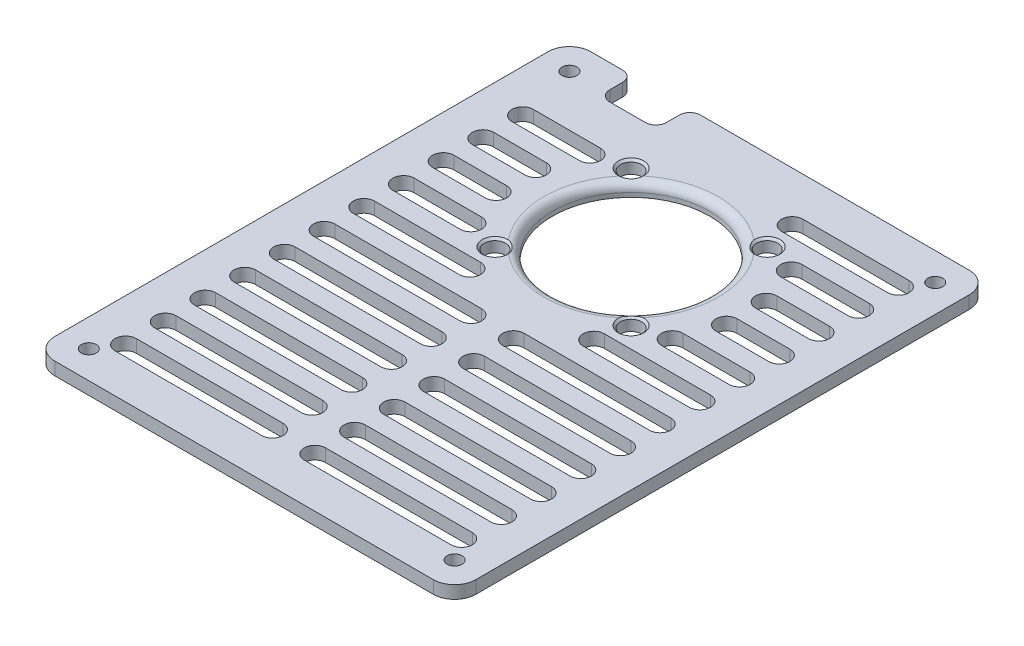
from build123d import *

# Parameters (mm, degrees)
SKETCH1_W           = 99
SKETCH1_H           = 126
BOSS_EXTRUDE1_DEPTH = 3
FILLET1_R           = 5
SKETCH5_R           = 18.5
SKETCH5_R_2         = 2.5
CUT_EXTRUDE4_DEPTH  = 81.176368089
SKETCH2_R           = 1.75
CUT_EXTRUDE1_DEPTH  = 81.176368089
CHAMFER1_SIZE       = 0.5
FILLET3_R           = 2
CUT_EXTRUDE3_DEPTH  = 81.176368089
SKETCH3_W           = 13.330399243
SKETCH3_H           = 8
CUT_EXTRUDE2_DEPTH  = 81.176368089
FILLET2_R           = 2.5


with BuildPart() as part:
    # Sketch1 → Boss-Extrude1 (new body)
    with BuildSketch(Plane(origin=(0, 0, 0), x_dir=(1, 0, 0), z_dir=(0, 1, 0))):
        Rectangle(SKETCH1_W, SKETCH1_H)
    extrude(amount=BOSS_EXTRUDE1_DEPTH)

    # Fillet1
    fillet1_edges = [part.edges().sort_by_distance(p)[0] for p in [
        (49.5, 1.5, 63),
        (-49.5, 1.5, 63),
        (-49.5, 1.5, -63),
        (49.5, 1.5, -63),
    ]]
    fillet(fillet1_edges, radius=FILLET1_R)

    # Sketch5 → Cut-Extrude4 (cut, through all)
    with BuildSketch(Plane(origin=(0, 3, 0), x_dir=(1, 0, 0), z_dir=(0, 1, 0))):
        with Locations(Location((0, 28, 0), (0, 0, 270))):
            Circle(SKETCH5_R)
        with Locations(Location((16, 44, 0), (0, 0, 270))):
            Circle(SKETCH5_R_2)
        with Locations(Location((16, 12, 0), (0, 0, 90))):
            Circle(SKETCH5_R_2)
        with Locations(Location((-16, 12, 0), (0, 0, 270))):
            Circle(SKETCH5_R_2)
        with Locations(Location((-16, 44, 0), (0, 0, 90))):
            Circle(SKETCH5_R_2)
    extrude(amount=-CUT_EXTRUDE4_DEPTH, mode=Mode.SUBTRACT)

    # Sketch2 → Cut-Extrude1 (cut, through all)
    with BuildSketch(Plane(origin=(0, 3, 0), x_dir=(1, 0, 0), z_dir=(0, 1, 0))):
        with Locations(Location((-43, 56.5, 0), (0, 0, 270))):
            Circle(SKETCH2_R)
        with Locations(Location((43, 56.5, 0), (0, 0, 90))):
            Circle(SKETCH2_R)
        with Locations(Location((43, -56.5, 0), (0, 0, 270))):
            Circle(SKETCH2_R)
        with Locations(Location((-43, -56.5, 0), (0, 0, 90))):
            Circle(SKETCH2_R)
    extrude(amount=-CUT_EXTRUDE1_DEPTH, mode=Mode.SUBTRACT)

    # Chamfer1
    chamfer1_edges = [part.edges().sort_by_distance(p)[0] for p in [
        (-16, 3, -41.5),
        (-16, 3, -14.5),
        (16, 3, -9.5),
        (16, 3, -46.5),
    ]]
    chamfer(chamfer1_edges, length=CHAMFER1_SIZE)

    # Fillet3
    # the kernel refuses this fillet: 2 mm, written as the material it takes off along each edge
    with BuildSketch(Plane(origin=(0, 3, -28), x_dir=(0, 0, 1), z_dir=(-1, 0, 0))) as fillet3_piece_1:
        with BuildLine():
            CenterArc((18.5 + FILLET3_R, -FILLET3_R), FILLET3_R, 90, 90)
            Line((18.5, -FILLET3_R), (18.5, 0))
            Line((18.5, 0), (18.5 + FILLET3_R, 0))
        make_face()
    revolve(axis=Axis((0, 3, -28), (0, 1, 0)), mode=Mode.SUBTRACT)

    # Sketch4 → Cut-Extrude3 (cut, through all)
    with BuildSketch(Plane(origin=(0, 3, 0), x_dir=(1, 0, 0), z_dir=(0, 1, 0))):
        with BuildLine():
            Line((-39.5, -48.833333333), (-5, -48.833333333))
            ThreePointArc((-5, -48.833333333), (-2.5, -51.333333333), (-5, -53.833333333))
            Line((-5, -53.833333333), (-39.5, -53.833333333))
            ThreePointArc((-39.5, -53.833333333), (-42, -51.333333333), (-39.5, -48.833333333))
        make_face()
        with BuildLine():
            Line((-39.5, -39.5), (-5, -39.5))
            ThreePointArc((-5, -39.5), (-2.5, -42), (-5, -44.5))
            Line((-5, -44.5), (-39.5, -44.5))
            ThreePointArc((-39.5, -44.5), (-42, -42), (-39.5, -39.5))
        make_face()
        with BuildLine():
            Line((-39.5, -30.166666667), (-5, -30.166666667))
            ThreePointArc((-5, -30.166666667), (-2.5, -32.666666667), (-5, -35.166666667))
            Line((-5, -35.166666667), (-39.5, -35.166666667))
            ThreePointArc((-39.5, -35.166666667), (-42, -32.666666667), (-39.5, -30.166666667))
        make_face()
        with BuildLine():
            Line((-39.5, -20.833333333), (-5, -20.833333333))
            ThreePointArc((-5, -20.833333333), (-2.5, -23.333333333), (-5, -25.833333333))
            Line((-5, -25.833333333), (-39.5, -25.833333333))
            ThreePointArc((-39.5, -25.833333333), (-42, -23.333333333), (-39.5, -20.833333333))
        make_face()
        with BuildLine():
            Line((-39.5, -11.5), (-5, -11.5))
            ThreePointArc((-5, -11.5), (-2.5, -14), (-5, -16.5))
            Line((-5, -16.5), (-39.5, -16.5))
            ThreePointArc((-39.5, -16.5), (-42, -14), (-39.5, -11.5))
        make_face()
        with BuildLine():
            Line((-39.5, -2.166666667), (-5, -2.166666667))
            ThreePointArc((-5, -2.166666667), (-2.5, -4.666666667), (-5, -7.166666667))
            Line((-5, -7.166666667), (-39.5, -7.166666667))
            ThreePointArc((-39.5, -7.166666667), (-42, -4.666666667), (-39.5, -2.166666667))
        make_face()
        with BuildLine():
            Line((-39.5, 7.166666667), (-14.553540997, 7.166666667))
            ThreePointArc((-14.553540997, 7.166666667), (-12.053540997, 4.666666667), (-14.553540997, 2.166666667))
            Line((-14.553540997, 2.166666667), (-39.5, 2.166666667))
            ThreePointArc((-39.5, 2.166666667), (-42, 4.666666667), (-39.5, 7.166666667))
        make_face()
        with BuildLine():
            Line((-39.5, 16.5), (-23.669600757, 16.5))
            ThreePointArc((-23.669600757, 16.5), (-21.169600757, 14), (-23.669600757, 11.5))
            Line((-23.669600757, 11.5), (-39.5, 11.5))
            ThreePointArc((-39.5, 11.5), (-42, 14), (-39.5, 16.5))
        make_face()
        with BuildLine():
            Line((-39.5, 25.833333333), (-27.101147987, 25.833333333))
            ThreePointArc((-27.101147987, 25.833333333), (-24.601147987, 23.333333333), (-27.101147987, 20.833333333))
            Line((-27.101147987, 20.833333333), (-39.5, 20.833333333))
            ThreePointArc((-39.5, 20.833333333), (-42, 23.333333333), (-39.5, 25.833333333))
        make_face()
        with BuildLine():
            Line((-39.5, 35.166666667), (-27.101147987, 35.166666667))
            ThreePointArc((-27.101147987, 35.166666667), (-24.601147987, 32.666666667), (-27.101147987, 30.166666667))
            Line((-27.101147987, 30.166666667), (-39.5, 30.166666667))
            ThreePointArc((-39.5, 30.166666667), (-42, 32.666666667), (-39.5, 35.166666667))
        make_face()
        with BuildLine():
            Line((39.5, 44.5), (23.669600757, 44.5))
            ThreePointArc((23.669600757, 44.5), (21.169600757, 42), (23.669600757, 39.5))
            Line((23.669600757, 39.5), (39.5, 39.5))
            ThreePointArc((39.5, 39.5), (42, 42), (39.5, 44.5))
        make_face()
        with BuildLine():
            Line((-39.5, 44.5), (-23.669600757, 44.5))
            ThreePointArc((-23.669600757, 44.5), (-21.169600757, 42), (-23.669600757, 39.5))
            Line((-23.669600757, 39.5), (-39.5, 39.5))
            ThreePointArc((-39.5, 39.5), (-42, 42), (-39.5, 44.5))
        make_face()
        with BuildLine():
            Line((39.5, 35.166666667), (27.101147987, 35.166666667))
            ThreePointArc((27.101147987, 35.166666667), (24.601147987, 32.666666667), (27.101147987, 30.166666667))
            Line((27.101147987, 30.166666667), (39.5, 30.166666667))
            ThreePointArc((39.5, 30.166666667), (42, 32.666666667), (39.5, 35.166666667))
        make_face()
        with BuildLine():
            Line((39.5, 25.833333333), (27.101147987, 25.833333333))
            ThreePointArc((27.101147987, 25.833333333), (24.601147987, 23.333333333), (27.101147987, 20.833333333))
            Line((27.101147987, 20.833333333), (39.5, 20.833333333))
            ThreePointArc((39.5, 20.833333333), (42, 23.333333333), (39.5, 25.833333333))
        make_face()
        with BuildLine():
            Line((39.5, 16.5), (23.669600757, 16.5))
            ThreePointArc((23.669600757, 16.5), (21.169600757, 14), (23.669600757, 11.5))
            Line((23.669600757, 11.5), (39.5, 11.5))
            ThreePointArc((39.5, 11.5), (42, 14), (39.5, 16.5))
        make_face()
        with BuildLine():
            Line((39.5, 7.166666667), (14.553540997, 7.166666667))
            ThreePointArc((14.553540997, 7.166666667), (12.053540997, 4.666666667), (14.553540997, 2.166666667))
            Line((14.553540997, 2.166666667), (39.5, 2.166666667))
            ThreePointArc((39.5, 2.166666667), (42, 4.666666667), (39.5, 7.166666667))
        make_face()
        with BuildLine():
            Line((39.5, -2.166666667), (5, -2.166666667))
            ThreePointArc((5, -2.166666667), (2.5, -4.666666667), (5, -7.166666667))
            Line((5, -7.166666667), (39.5, -7.166666667))
            ThreePointArc((39.5, -7.166666667), (42, -4.666666667), (39.5, -2.166666667))
        make_face()
        with BuildLine():
            Line((39.5, -11.5), (5, -11.5))
            ThreePointArc((5, -11.5), (2.5, -14), (5, -16.5))
            Line((5, -16.5), (39.5, -16.5))
            ThreePointArc((39.5, -16.5), (42, -14), (39.5, -11.5))
        make_face()
        with BuildLine():
            Line((39.5, -20.833333333), (5, -20.833333333))
            ThreePointArc((5, -20.833333333), (2.5, -23.333333333), (5, -25.833333333))
            Line((5, -25.833333333), (39.5, -25.833333333))
            ThreePointArc((39.5, -25.833333333), (42, -23.333333333), (39.5, -20.833333333))
        make_face()
        with BuildLine():
            Line((39.5, -30.166666667), (5, -30.166666667))
            ThreePointArc((5, -30.166666667), (2.5, -32.666666667), (5, -35.166666667))
            Line((5, -35.166666667), (39.5, -35.166666667))
            ThreePointArc((39.5, -35.166666667), (42, -32.666666667), (39.5, -30.166666667))
        make_face()
        with BuildLine():
            Line((39.5, -39.5), (5, -39.5))
            ThreePointArc((5, -39.5), (2.5, -42), (5, -44.5))
            Line((5, -44.5), (39.5, -44.5))
            ThreePointArc((39.5, -44.5), (42, -42), (39.5, -39.5))
        make_face()
        with BuildLine():
            Line((39.5, -48.833333333), (5, -48.833333333))
            ThreePointArc((5, -48.833333333), (2.5, -51.333333333), (5, -53.833333333))
            Line((5, -53.833333333), (39.5, -53.833333333))
            ThreePointArc((39.5, -53.833333333), (42, -51.333333333), (39.5, -48.833333333))
        make_face()
        with BuildLine():
            Line((14.553540997, 53.833333333), (39.5, 53.833333333))
            ThreePointArc((39.5, 53.833333333), (42, 51.333333333), (39.5, 48.833333333))
            Line((39.5, 48.833333333), (14.553540997, 48.833333333))
            ThreePointArc((14.553540997, 48.833333333), (12.053540997, 51.333333333), (14.553540997, 53.833333333))
        make_face()
    extrude(amount=-CUT_EXTRUDE3_DEPTH, mode=Mode.SUBTRACT)

    # Sketch3 → Cut-Extrude2 (cut, through all)
    with BuildSketch(Plane(origin=(0, 3, 0), x_dir=(1, 0, 0), z_dir=(0, 1, 0))):
        with Locations((-27.834800378, 59)):
            Rectangle(SKETCH3_W, SKETCH3_H)
    extrude(amount=-CUT_EXTRUDE2_DEPTH, mode=Mode.SUBTRACT)

    # Fillet2
    fillet2_edges = [part.edges().sort_by_distance(p)[0] for p in [
        (-34.5, 1.5, -55),
        (-34.5, 1.5, -63),
        (-21.169600757, 1.5, -63),
        (-21.169600757, 1.5, -55),
    ]]
    fillet(fillet2_edges, radius=FILLET2_R)


solid = part.part
